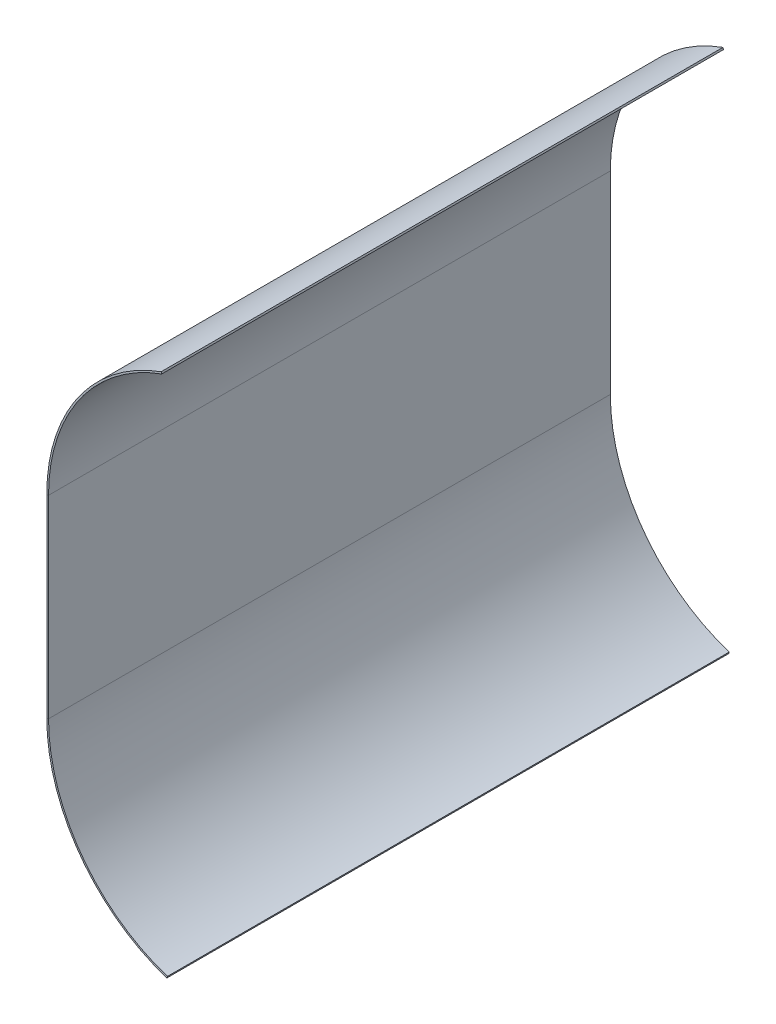
from build123d import *

# Parameters (mm, degrees)
BASE_FLANGE1_DEPTH = 508


# Sheet-metal steps are written as plain solids
with BuildPart() as part:
    # Sketch1 → Base-Flange1 (new body)
    with BuildSketch(Plane.XY):
        with BuildLine():
            ThreePointArc((-48.565883378, -149.470419742), (-127.147133378, -92.377799713), (-157.1625, 0))
            Line((-157.1625, 0), (-157.1625, 175.02378))
            ThreePointArc((-157.1625, 175.02378), (-128.739983161, 265.168486678), (-53.752740775, 322.708221514))
            Line((-53.752740775, 322.708221514), (-53.209783798, 321.216459479))
            ThreePointArc((-53.209783798, 321.216459479), (-127.43957929, 264.257934085), (-155.575, 175.02378))
            Line((-155.575, 175.02378), (-155.575, 0))
            ThreePointArc((-155.575, 0), (-125.8628189, -91.444690625), (-48.0753189, -147.960617523))
            Line((-48.0753189, -147.960617523), (-48.565883378, -149.470419742))
        make_face()
    extrude(amount=BASE_FLANGE1_DEPTH)


solid = part.part
